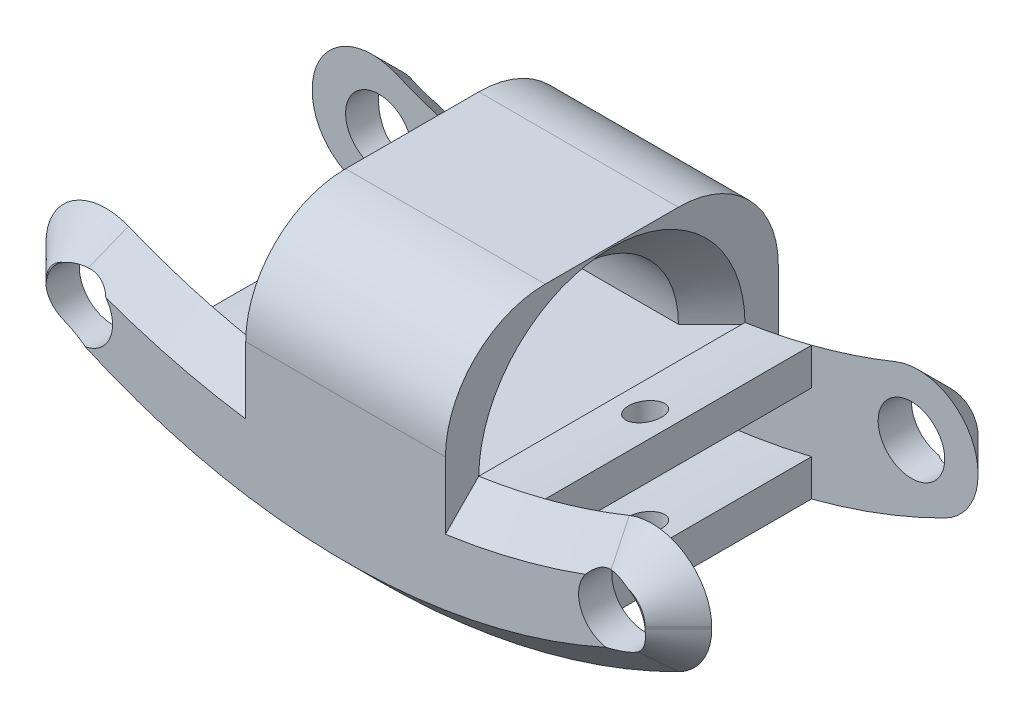
from build123d import *

# Parameters (mm, degrees)
SKETCH2_W               = 50
SKETCH2_H               = 10
BOSS_EXTRUDE2_DEPTH     = 12.5
CUT_EXTRUDE1_DEPTH      = 30
BOSS_EXTRUDE3_DEPTH     = 25
CUT_SWEEP1_START        = -10
CUT_SWEEP1_DEPTH        = 20
CUT_EXTRUDE3_DEPTH      = 31.300334762
CUT_EXTRUDE3_DEPTH_BACK = 31.300334762
SKETCH9_W               = 12.5
SKETCH9_H               = 20
CUT_EXTRUDE4_DEPTH      = 38.240573092
CUT_EXTRUDE4_DEPTH_BACK = 38.240573092
SKETCH10_R              = 2.5
FILLET1_R               = 4.5
BOSS_EXTRUDE4_DEPTH     = 25
SKETCH12_W              = 15
SKETCH12_H              = 25
BOSS_EXTRUDE5_DEPTH     = 10
SKETCH13_W              = 15
SKETCH13_H              = 7.5
CUT_EXTRUDE5_DEPTH      = 15
FILLET2_R               = 7.5
CHAMFER1_SIZE           = 2.5
SKETCH14_R              = 1.25
CUT_EXTRUDE6_DEPTH      = 31.300334801


# Read off the part's stored shape, not the designer's step: Cut-Sweep1
with BuildPart() as part:
    # Sketch2 → Boss-Extrude2 (new, symmetric)
    with BuildSketch(Plane.XY):
        Rectangle(SKETCH2_W, SKETCH2_H)
    extrude(amount=BOSS_EXTRUDE2_DEPTH, both=True)

    # Sketch4 → Cut-Extrude1 (cut)
    with BuildSketch(Plane.XY.offset(12.5)):
        with BuildLine():
            ThreePointArc((-25, 5), (0, -1.698729811), (25, 5))
            Line((25, 5), (-25, 5))
        make_face()
        with BuildLine():
            ThreePointArc((-20.917760076, 2.887094942), (-22.701682649, 4.440465894), (-25, 5))
            ThreePointArc((-25, 5), (-22.983173509, 3.896611251), (-20.917760076, 2.887094942))
        make_face()
        with BuildLine():
            ThreePointArc((20.917760076, 2.887094942), (22.983173509, 3.896611251), (25, 5))
            ThreePointArc((25, 5), (22.701682649, 4.440465894), (20.917760076, 2.887094942))
        make_face()
    extrude(amount=-CUT_EXTRUDE1_DEPTH, mode=Mode.SUBTRACT)

    # Sketch5 → Boss-Extrude3 (add)
    with BuildSketch(Plane.XY.offset(12.5)):
        with BuildLine():
            Line((-25, -5), (25, -5))
            ThreePointArc((25, -5), (0, -11.698729811), (-25, -5))
        make_face()
    extrude(amount=-BOSS_EXTRUDE3_DEPTH)

    # Cut-Sweep1 outline → Cut-Sweep1 (cut)
    with BuildSketch(Plane.XY.offset(CUT_SWEEP1_START)):
        with BuildLine():
            add(Edge.make_bspline(
                [(-25, 2.5), (-21.253500833, 0.199927343), (-17.067229765, -1.632514938), (-8.275016497, -4.051157904), (-3.648345569, -4.627645942), (5.503663893, -4.454359925), (10.042002415, -3.694374629), (16.414054895, -1.702451766), (18.475128801, -0.886847449), (22.008148653, 0.771096587), (23.52294083, 1.614101018), (25, 2.511810109)],
                knots=[0.02326503, 0.02326503, 0.02326503, 0.02326503, 0.267448772, 0.267448772, 0.511632515, 0.511632515, 0.755816257, 0.755816257, 0.877908129, 0.877908129, 0.97617035, 0.97617035, 0.97617035, 0.97617035], degree=3))
            Line((-25, 2.5), (-25.000060474, -2.499967049))
            add(Edge.make_bspline(
                [(-25.000060474, -2.499967049), (-25.000040316, -2.499978032), (-25.000020158, -2.499989016), (-20.778816253, -4.800072797), (-16.142681087, -6.570132845), (-6.419429734, -8.71931154), (-1.36380324, -9.101751255), (8.607962803, -8.404053642), (13.49904302, -7.337156159), (20.334892165, -4.814088369), (22.522489044, -3.83299718), (24.744004615, -2.638703766), (24.87225444, -2.568990209), (25.000024293, -2.498810898)],
                knots=[0.023263864, 0.023263864, 0.023263864, 0.023263864, 0.02326503, 0.02326503, 0.267448772, 0.267448772, 0.511632515, 0.511632515, 0.755816257, 0.755816257, 0.877908129, 0.877908129, 0.885418206, 0.885418206, 0.885418206, 0.885418206], degree=3))
            Line((25.000024293, -2.498810898), (25, 2.511810109))
        make_face()
    extrude(amount=CUT_SWEEP1_DEPTH, mode=Mode.SUBTRACT)

    # Sketch9 → Cut-Extrude3 (cut, two sides: drawn at the far end of the back side and taken through both)
    with BuildSketch(Plane(origin=(0, 0, 0), x_dir=(1, 0, 0), z_dir=(0, 1, 0)).offset(-CUT_EXTRUDE3_DEPTH_BACK)):
        with Locations((18.75, 0)):
            Rectangle(SKETCH9_W, SKETCH9_H)
        with Locations((-18.75, 0)):
            Rectangle(SKETCH9_W, SKETCH9_H)
    extrude(amount=CUT_EXTRUDE3_DEPTH + CUT_EXTRUDE3_DEPTH_BACK, mode=Mode.SUBTRACT)

    # Sketch10 → Cut-Extrude4 (cut, two sides: drawn at the far end of the back side and taken through both)
    with BuildSketch(Plane.XY.offset(12.5).offset(-CUT_EXTRUDE4_DEPTH_BACK)):
        with Locations((-20, -2.52448676)):
            Circle(SKETCH10_R)
        with Locations(Location((20, -2.52448676, 0), (0, 0, 90))):
            Circle(SKETCH10_R)
    extrude(amount=CUT_EXTRUDE4_DEPTH + CUT_EXTRUDE4_DEPTH_BACK, mode=Mode.SUBTRACT)

    # Fillet1
    fillet1_edges = [part.edges().sort_by_distance(p)[0] for p in [
        (25, -5, -11.25),
        (25, 5, -11.25),
        (25, -5, 11.25),
        (25, 5, 11.25),
        (-25, -5, 11.25),
        (-25, 5, 11.25),
        (-25, -5, -11.25),
        (-25, 5, -11.25),
    ]]
    fillet(fillet1_edges, radius=FILLET1_R)

    # Sketch11 → Boss-Extrude4 (add)
    with BuildSketch(Plane.XY.offset(12.5)):
        with BuildLine():
            Line((-7.5, -1.133029644), (7.5, -1.133029644))
            ThreePointArc((7.5, -1.133029644), (0, -1.698729811), (-7.5, -1.133029644))
        make_face()
    extrude(amount=-BOSS_EXTRUDE4_DEPTH)

    # Sketch12 → Boss-Extrude5 (add)
    with BuildSketch(Plane(origin=(0, -1.133029644, 0), x_dir=(1, 0, 0), z_dir=(0, 1, 0))):
        Rectangle(SKETCH12_W, SKETCH12_H)
    extrude(amount=BOSS_EXTRUDE5_DEPTH)

    # Sketch13 → Cut-Extrude5 (cut)
    with BuildSketch(Plane.ZY.offset(7.5)):
        with Locations((0, 2.5)):
            Rectangle(SKETCH13_W, SKETCH13_H)
    extrude(amount=-CUT_EXTRUDE5_DEPTH, mode=Mode.SUBTRACT)

    # Fillet2
    # the kernel refuses this fillet: 7.5 mm, written as the material it adds along each edge
    with BuildSketch(Plane(origin=(-7.5, 6.25, 7.5), x_dir=(0, -1, 0), z_dir=(1, 0, 0)), Plane(origin=(-7.5, 6.25, -7.5), x_dir=(0, 0, 1), z_dir=(1, 0, 0))) as fillet2_piece_1:
        with BuildLine():
            CenterArc((FILLET2_R, FILLET2_R), FILLET2_R, 180, 90)
            Line((0, FILLET2_R), (-FILLET2_R * 0.02, FILLET2_R))
            Line((-FILLET2_R * 0.02, FILLET2_R), (-FILLET2_R * 0.02, -FILLET2_R * 0.02))
            Line((-FILLET2_R * 0.02, -FILLET2_R * 0.02), (FILLET2_R, -FILLET2_R * 0.02))
            Line((FILLET2_R, -FILLET2_R * 0.02), (FILLET2_R, 0))
        make_face()
    extrude(amount=15)
    # the kernel refuses this fillet: 7.5 mm, written as the material it takes off along each edge
    with BuildSketch(Plane(origin=(-7.5, 8.866970356, 12.5), x_dir=(0, -1, 0), z_dir=(1, 0, 0)), Plane(origin=(7.5, 8.866970356, -12.5), x_dir=(0, -1, 0), z_dir=(-1, 0, 0))) as fillet2_2_piece_1:
        with BuildLine():
            CenterArc((FILLET2_R, FILLET2_R), FILLET2_R, 180, 90)
            Line((0, FILLET2_R), (-FILLET2_R * 0.02, FILLET2_R))
            Line((-FILLET2_R * 0.02, FILLET2_R), (-FILLET2_R * 0.02, -FILLET2_R * 0.02))
            Line((-FILLET2_R * 0.02, -FILLET2_R * 0.02), (FILLET2_R, -FILLET2_R * 0.02))
            Line((FILLET2_R, -FILLET2_R * 0.02), (FILLET2_R, 0))
        make_face()
    extrude(amount=15, mode=Mode.SUBTRACT)

    # Chamfer1
    # the kernel refuses this chamfer: 2.5 mm, written as the material it takes off along each edge
    with BuildSketch(Plane(origin=(-7.5, -1.25, 0), x_dir=(0, -0.7466303776369829, 0.6652391142962478), z_dir=(0, -0.6652391142962478, -0.7466303776369829))) as chamfer1_piece_1_section:
        Polygon((7.5, -CHAMFER1_SIZE), (7.5 + CHAMFER1_SIZE, 0), (7.5, 0), align=None)
    chamfer1_piece_1 = revolve(axis=Axis((-7.5, -1.25, 0), (-1, 0, 0)), revolution_arc=276.598655592, mode=Mode.PRIVATE)
    chamfer1_piece_1 = split(chamfer1_piece_1, bisect_by=Plane(origin=(-7.247072009, -1.25, 8.62339763), z_dir=(0, 1, 0)), keep=Keep.TOP, mode=Mode.PRIVATE)
    add(chamfer1_piece_1, mode=Mode.SUBTRACT)
    with BuildSketch(Plane(origin=(7.5, -1.25, 0), x_dir=(0, -0.7466303776370209, -0.6652391142962052), z_dir=(0, -0.6652391142962052, 0.7466303776370209))) as chamfer1_piece_2_section:
        Polygon((7.5, -CHAMFER1_SIZE), (7.5 + CHAMFER1_SIZE, 0), (7.5, 0), align=None)
    chamfer1_piece_2 = revolve(axis=Axis((7.5, -1.25, 0), (1, 0, 0)), revolution_arc=276.598655592, mode=Mode.PRIVATE)
    chamfer1_piece_2 = split(chamfer1_piece_2, bisect_by=Plane(origin=(7.247071893, -1.25, -8.623398255), z_dir=(0, 1, 0)), keep=Keep.TOP, mode=Mode.PRIVATE)
    add(chamfer1_piece_2, mode=Mode.SUBTRACT)
    with BuildSketch(Plane(origin=(0, 48.301270189, 12.5), x_dir=(-0.02198119644653779, -0.9997583843123191, 0), z_dir=(0.9997583843123191, -0.02198119644653779, 0))) as chamfer1_piece_3_section:
        Polygon((50, CHAMFER1_SIZE), (50 + CHAMFER1_SIZE, 0), (50, 0), align=None)
    chamfer1_piece_3 = revolve(axis=Axis((0, 48.301270189, 12.5), (0, 0, -1)), revolution_arc=20.835677915, mode=Mode.PRIVATE)
    chamfer1_piece_3 = split(chamfer1_piece_3, bisect_by=Plane(origin=(-7.5, -1.514874609, 11.666526821), z_dir=(-1, 0, 0)), keep=Keep.TOP, mode=Mode.PRIVATE)
    add(chamfer1_piece_3, mode=Mode.SUBTRACT)
    with BuildSketch(Plane(origin=(-20.5, -2.196254503, 12.5), x_dir=(0.376146788990824, 0.9265600860882647, 0), z_dir=(0.9265600860882647, -0.376146788990824, 0))) as chamfer1_piece_4:
        Polygon((4.5 - CHAMFER1_SIZE, 0), (4.5, -CHAMFER1_SIZE), (4.5, 0), align=None)
    revolve(axis=Axis((-20.5, -2.196254503, 12.5), (0, 0, 1)), revolution_arc=112.095209143, mode=Mode.SUBTRACT)
    with BuildSketch(Plane(origin=(-25, -2.196254503, 12.5), x_dir=(0.9996219169112968, 0, 0.027495876610586317), z_dir=(0, -1, 0)), Plane(origin=(25, -2.318921834, 12.5), x_dir=(-0.9996219169112968, 0, 0.027495876610586317), z_dir=(0, 1, 0))) as chamfer1_piece_5:
        Polygon((CHAMFER1_SIZE * 0.999621916911, -CHAMFER1_SIZE * 0.0274958766106), (-CHAMFER1_SIZE * 0.0274958766106, -CHAMFER1_SIZE * 0.999621916911), (0, 0), align=None)
    extrude(amount=0.122667331, mode=Mode.SUBTRACT)
    with BuildSketch(Plane(origin=(-20.5, -2.318921834, 12.5), x_dir=(-0.45054945054944856, -0.8927514730369198, 0), z_dir=(0.8927514730369198, -0.45054945054944856, 0))) as chamfer1_piece_6:
        Polygon((4.5 - CHAMFER1_SIZE, 0), (4.5, CHAMFER1_SIZE), (4.5, 0), align=None)
    revolve(axis=Axis((-20.5, -2.318921834, 12.5), (0, 0, -1)), revolution_arc=63.221058408, mode=Mode.SUBTRACT)
    with BuildSketch(Plane(origin=(0, 38.301270189, 12.5), x_dir=(0.4505494505494507, -0.8927514730369186, 0), z_dir=(0.8927514730369186, 0.4505494505494507, 0))) as chamfer1_piece_7:
        Polygon((50 - CHAMFER1_SIZE, 0), (50, CHAMFER1_SIZE), (50, 0), align=None)
    revolve(axis=Axis((0, 38.301270189, 12.5), (0, 0, -1)), revolution_arc=53.557883185, mode=Mode.SUBTRACT)
    with BuildSketch(Plane(origin=(20.5, -2.318921834, 12.5), x_dir=(0.45054945054945095, -0.8927514730369184, 0), z_dir=(-0.8927514730369184, -0.45054945054945095, 0))) as chamfer1_piece_8:
        Polygon((4.5 - CHAMFER1_SIZE, 0), (4.5, -CHAMFER1_SIZE), (4.5, 0), align=None)
    revolve(axis=Axis((20.5, -2.318921834, 12.5), (0, 0, 1)), revolution_arc=63.221058408, mode=Mode.SUBTRACT)
    with BuildSketch(Plane(origin=(0, 48.301270189, 12.5), x_dir=(0.3761467889908257, -0.926560086088264, 0), z_dir=(0.926560086088264, 0.3761467889908257, 0))) as chamfer1_piece_9_section:
        Polygon((50 + CHAMFER1_SIZE, 0), (50, CHAMFER1_SIZE), (50, 0), align=None)
    chamfer1_piece_9 = revolve(axis=Axis((0, 48.301270189, 12.5), (0, 0, -1)), revolution_arc=20.835677915, mode=Mode.PRIVATE)
    chamfer1_piece_9 = split(chamfer1_piece_9, bisect_by=Plane(origin=(7.5, 0.534529901, 11.769055481), z_dir=(1, 0, 0)), keep=Keep.TOP, mode=Mode.PRIVATE)
    add(chamfer1_piece_9, mode=Mode.SUBTRACT)
    with BuildSketch(Plane(origin=(20.5, -2.196254503, 12.5), x_dir=(-0.37614678899082565, 0.9265600860882641, 0), z_dir=(-0.9265600860882641, -0.37614678899082565, 0))) as chamfer1_piece_10:
        Polygon((4.5 - CHAMFER1_SIZE, 0), (4.5, CHAMFER1_SIZE), (4.5, 0), align=None)
    revolve(axis=Axis((20.5, -2.196254503, 12.5), (0, 0, -1)), revolution_arc=112.095209143, mode=Mode.SUBTRACT)
    with BuildSketch(Plane(origin=(0, 48.301270189, -12.5), x_dir=(-0.37614678899082576, -0.926560086088264, 0), z_dir=(-0.926560086088264, 0.37614678899082576, 0))) as chamfer1_piece_11_section:
        Polygon((50, CHAMFER1_SIZE), (50 + CHAMFER1_SIZE, 0), (50, 0), align=None)
    chamfer1_piece_11 = revolve(axis=Axis((0, 48.301270189, -12.5), (0, 0, 1)), revolution_arc=20.835677915, mode=Mode.PRIVATE)
    chamfer1_piece_11 = split(chamfer1_piece_11, bisect_by=Plane(origin=(-7.5, -0.226958803, -11.627193744), z_dir=(-1, 0, 0)), keep=Keep.TOP, mode=Mode.PRIVATE)
    add(chamfer1_piece_11, mode=Mode.SUBTRACT)
    with BuildSketch(Plane(origin=(-20.5, -2.196254503, -12.5), x_dir=(-1, 0, 0), z_dir=(0, -1, 0))) as chamfer1_piece_12:
        Polygon((4.5 - CHAMFER1_SIZE, 0), (4.5, -CHAMFER1_SIZE), (4.5, 0), align=None)
    revolve(axis=Axis((-20.5, -2.196254503, -12.5), (0, 0, -1)), revolution_arc=112.095209143, mode=Mode.SUBTRACT)
    with BuildSketch(Plane(origin=(-25, -2.196254503, -12.5), x_dir=(0.9996219169112968, 0, -0.027495876610586317), z_dir=(0, -1, 0)), Plane(origin=(25, -2.318921834, -12.5), x_dir=(-0.9996219169112968, 0, -0.027495876610586317), z_dir=(0, 1, 0))) as chamfer1_piece_13:
        Polygon((CHAMFER1_SIZE * 0.999621916911, CHAMFER1_SIZE * 0.0274958766106), (-CHAMFER1_SIZE * 0.0274958766106, CHAMFER1_SIZE * 0.999621916911), (0, 0), align=None)
    extrude(amount=0.122667331, mode=Mode.SUBTRACT)
    with BuildSketch(Plane(origin=(-20.5, -2.318921834, -12.5), x_dir=(-1, 0, 0), z_dir=(0, 1, 0))) as chamfer1_piece_14:
        Polygon((4.5 - CHAMFER1_SIZE, 0), (4.5, CHAMFER1_SIZE), (4.5, 0), align=None)
    revolve(axis=Axis((-20.5, -2.318921834, -12.5), (0, 0, 1)), revolution_arc=63.221058408, mode=Mode.SUBTRACT)
    with BuildSketch(Plane(origin=(0, 38.301270189, -12.5), x_dir=(0.4505494505494507, -0.8927514730369186, 0), z_dir=(0.8927514730369186, 0.4505494505494507, 0))) as chamfer1_piece_15:
        Polygon((50 - CHAMFER1_SIZE, 0), (50, -CHAMFER1_SIZE), (50, 0), align=None)
    revolve(axis=Axis((0, 38.301270189, -12.5), (0, 0, -1)), revolution_arc=53.557883185, mode=Mode.SUBTRACT)
    with BuildSketch(Plane(origin=(20.5, -2.318921834, -12.5), x_dir=(0.45054945054945095, -0.8927514730369184, 0), z_dir=(-0.8927514730369184, -0.45054945054945095, 0))) as chamfer1_piece_16:
        Polygon((4.5 - CHAMFER1_SIZE, 0), (4.5, CHAMFER1_SIZE), (4.5, 0), align=None)
    revolve(axis=Axis((20.5, -2.318921834, -12.5), (0, 0, 1)), revolution_arc=63.221058408, mode=Mode.SUBTRACT)
    with BuildSketch(Plane(origin=(0, 48.301270189, -12.5), x_dir=(0.021981196446536518, -0.9997583843123191, 0), z_dir=(-0.9997583843123191, -0.021981196446536518, 0))) as chamfer1_piece_17_section:
        Polygon((50 + CHAMFER1_SIZE, 0), (50, CHAMFER1_SIZE), (50, 0), align=None)
    chamfer1_piece_17 = revolve(axis=Axis((0, 48.301270189, -12.5), (0, 0, 1)), revolution_arc=20.835677915, mode=Mode.PRIVATE)
    chamfer1_piece_17 = split(chamfer1_piece_17, bisect_by=Plane(origin=(7.5, -1.514874609, -11.666526821), z_dir=(1, 0, 0)), keep=Keep.TOP, mode=Mode.PRIVATE)
    add(chamfer1_piece_17, mode=Mode.SUBTRACT)
    with BuildSketch(Plane(origin=(20.5, -2.196254503, -12.5), x_dir=(-0.37614678899082643, 0.9265600860882637, 0), z_dir=(-0.9265600860882637, -0.37614678899082643, 0))) as chamfer1_piece_18:
        Polygon((4.5 - CHAMFER1_SIZE, 0), (4.5, -CHAMFER1_SIZE), (4.5, 0), align=None)
    revolve(axis=Axis((20.5, -2.196254503, -12.5), (0, 0, -1)), revolution_arc=112.095209143, mode=Mode.SUBTRACT)

    # Sketch14 → Cut-Extrude6 (cut, through all)
    with BuildSketch(Plane(origin=(0, 0, 0), x_dir=(1, 0, 0), z_dir=(0, 1, 0))):
        with Locations(Location((10, 0, 0), (0, 0, 270))):
            Circle(SKETCH14_R)
        with Locations(Location((-10, 0, 0), (0, 0, 270))):
            Circle(SKETCH14_R)
    extrude(amount=-CUT_EXTRUDE6_DEPTH, mode=Mode.SUBTRACT)


solid = part.part
